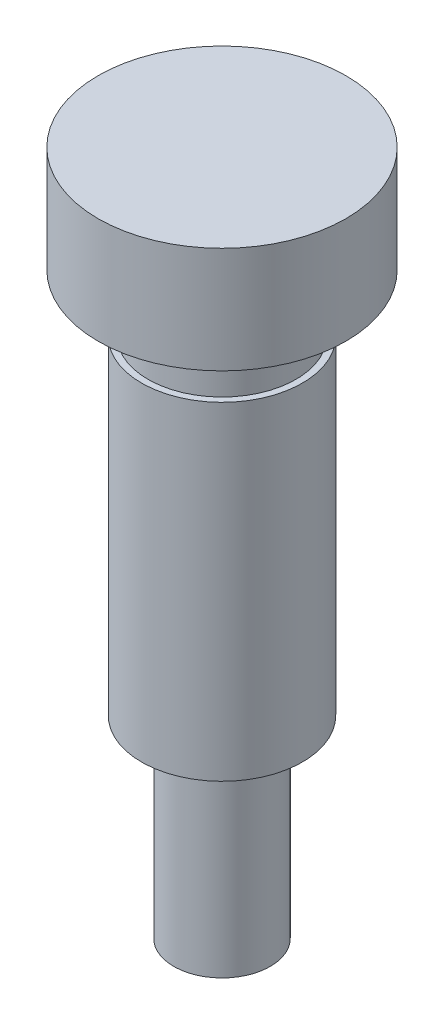
from build123d import *


with BuildPart() as part:
    # Sketch1 → Revolve1 (revolve)
    with BuildSketch(Plane.XY):
        Polygon((0, 0), (1.5, 0), (1.5, 6), (2.5, 6), (2.5, 16.2), (2.3, 16.2), (2.3, 18), (3.85, 18), (3.85, 21.3), (0, 21.3), align=None)
    revolve(axis=Axis((0, 21.3, 0), (0, -1, 0)))


solid = part.part
